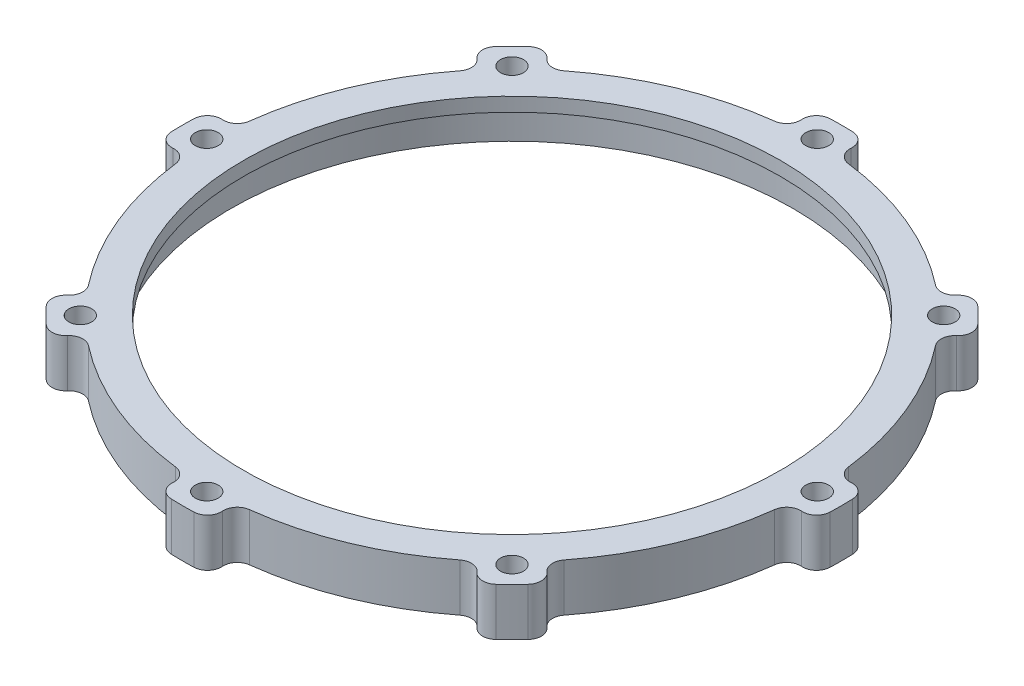
from build123d import *

# Parameters (mm, degrees)
PATTERN_CIRCULAR_1_COUNT = 8
CUT_EXTRUDE_START        = -10
CUT_EXTRUDE_1_DEPTH      = 10
PATTERN_CIRCULAR_2_COUNT = 8
FILLET_2_R               = 2


with BuildPart() as part:
    # 草图1 → 旋转1 (revolve)
    with BuildSketch(Plane.XY, mode=Mode.PRIVATE) as revolve_1_sk:
        Polygon((-40.5, 0), (-47.5, 0), (-47.5, 6.9), (-38.7, 6.9), (-38.7, 4.9), (-40.5, 4.9), align=None)
    revolve(revolve_1_sk.sketch.rotate(Axis((0, 0, 0), (0, 1, 0)), 270), axis=Axis((0, 0, 0), (0, 1, 0)))

    # 草图4 → M4 螺纹孔1 (revolve, cut)
    with BuildSketch(Plane(origin=(0, 0, 44), x_dir=(0, 0, -1), z_dir=(1, 0, 0))):
        Polygon((0, 0), (0, 8.991420021), (1.65, 8), (1.65, 0), align=None)
    hole_wizard_m4_1 = revolve(axis=Axis((0, -6.35, 44), (0, 1, 0)), mode=Mode.SUBTRACT)

    # 阵列(圆周)1: M4 螺纹孔1 ×8 about axis
    pattern_circular_1_axis = Axis((0, 0, 0), (0, 1, 0))
    for i in range(1, PATTERN_CIRCULAR_1_COUNT):
        add(hole_wizard_m4_1.rotate(pattern_circular_1_axis, i * 360 / PATTERN_CIRCULAR_1_COUNT), mode=Mode.SUBTRACT)

    # 草图5 → 切除-拉伸1 (cut)
    with BuildSketch(Plane.XZ.offset(CUT_EXTRUDE_START)):
        with BuildLine():
            Line((-30.848782296, 36.119283366), (-28.250990102, 33.077659504))
            ThreePointArc((-28.250990102, 33.077659504), (-16.646729308, 40.188759664), (-3.412970664, 43.365904017))
            Line((-3.412970664, 43.365904017), (-3.726807047, 47.353573352))
            ThreePointArc((-3.726807047, 47.353573352), (-18.177463037, 43.884277794), (-30.848782296, 36.119283366))
        make_face()
    cut_extrude_1 = extrude(amount=CUT_EXTRUDE_1_DEPTH, mode=Mode.SUBTRACT)

    # 阵列(圆周)2: 切除-拉伸1 ×8 about axis
    pattern_circular_2_axis = Axis((0, 0, 0), (0, 1, 0))
    for i in range(1, PATTERN_CIRCULAR_2_COUNT):
        add(cut_extrude_1.rotate(pattern_circular_2_axis, i * 360 / PATTERN_CIRCULAR_2_COUNT), mode=Mode.SUBTRACT)

    # 圆角2
    fillet_2_edges = [part.edges().sort_by_distance(p)[0] for p in [
        (-3.412970664, 3.45, 43.365904017),
        (-28.250990102, 3.45, 33.077659504),
        (-30.848782296, 3.45, 36.119283366),
        (-36.119283366, 3.45, 30.848782296),
        (-33.077659504, 3.45, 28.250990102),
        (-43.365904017, 3.45, 3.412970664),
        (-47.353573352, 3.45, 3.726807047),
        (-47.353573352, 3.45, -3.726807047),
        (-43.365904017, 3.45, -3.412970664),
        (-33.077659504, 3.45, -28.250990102),
        (-36.119283366, 3.45, -30.848782296),
        (-30.848782296, 3.45, -36.119283366),
        (-28.250990102, 3.45, -33.077659504),
        (-3.412970664, 3.45, -43.365904017),
        (-3.726807047, 3.45, -47.353573352),
        (3.726807047, 3.45, -47.353573352),
        (3.412970664, 3.45, -43.365904017),
        (28.250990102, 3.45, -33.077659504),
        (30.848782296, 3.45, -36.119283366),
        (36.119283366, 3.45, -30.848782296),
        (33.077659504, 3.45, -28.250990102),
        (43.365904017, 3.45, -3.412970664),
        (47.353573352, 3.45, -3.726807047),
        (47.353573352, 3.45, 3.726807047),
        (43.365904017, 3.45, 3.412970664),
        (33.077659504, 3.45, 28.250990102),
        (36.119283366, 3.45, 30.848782296),
        (30.848782296, 3.45, 36.119283366),
        (28.250990102, 3.45, 33.077659504),
        (3.412970664, 3.45, 43.365904017),
        (3.726807047, 3.45, 47.353573352),
        (-3.726807047, 3.45, 47.353573352),
    ]]
    fillet(fillet_2_edges, radius=FILLET_2_R - 0.0001)  # a hair under: the kernel refuses the full size


solid = part.part
